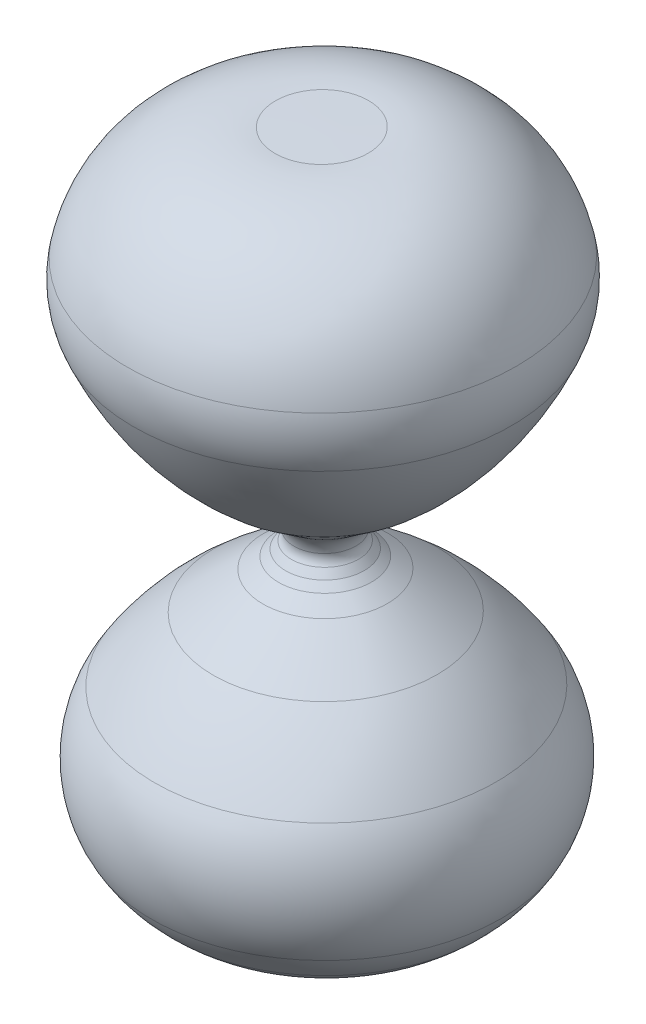
from build123d import *


with BuildPart() as part:
    # Sketch1 → Revolve7 (revolve)
    with BuildSketch(Plane.XY):
        with BuildLine():
            Line((0.005277751, 121.322127617), (8.730429134, 121.322127617))
            ThreePointArc((8.730429134, 121.322127617), (26.583253063, 116.163052209), (36.661754215, 100.550134615))
            ThreePointArc((36.661754215, 100.550134615), (36.977867771, 95.383429099), (35.712952177, 90.363990662))
            ThreePointArc((35.712952177, 90.363990662), (28.756780257, 78.151476585), (19.160242416, 67.883064374))
            Line((19.160242416, 67.883064374), (8.730429134, 60.003118726))
            ThreePointArc((8.730429134, 60.003118726), (7.188053174, 58.278469522), (6.4132916, 56.098312881))
            ThreePointArc((6.4132916, 56.098312881), (6.474001375, 55.099847398), (6.933146007, 54.211137544))
            Line((6.933146007, 54.211137544), (8.009640354, 52.893311881))
            Line((8.009640354, 52.893311881), (9.373582625, 51.694207193))
            Line((9.373582625, 51.694207193), (12.345831881, 49.674668697))
            ThreePointArc((12.345831881, 49.674668697), (17.101910845, 46.31694011), (21.734605697, 42.790927235))
            ThreePointArc((21.734605697, 42.790927235), (27.757810181, 37.252845213), (32.88625169, 30.877232896))
            ThreePointArc((32.88625169, 30.877232896), (36.491433717, 20.136699132), (33.87154544, 9.114331492))
            ThreePointArc((33.87154544, 9.114331492), (31.975925802, 6.242578427), (29.690508482, 3.670185155))
            ThreePointArc((29.690508482, 3.670185155), (26.348382743, 0.893967319), (22.607701735, -1.316122164))
            ThreePointArc((22.607701735, -1.316122164), (21.469276076, -1.789036005), (20.282313387, -2.121872383))
            Line((20.282313387, -2.121872383), (1.165640252, -2.121872383))
            Line((1.165640252, -2.121872383), (0.005277751, 121.322127617))
        make_face()
    revolve(axis=Axis((0.005277751, 121.322127617, 0), (0.009399494831836323, -0.9999558237726837, 0)))


solid = part.part
